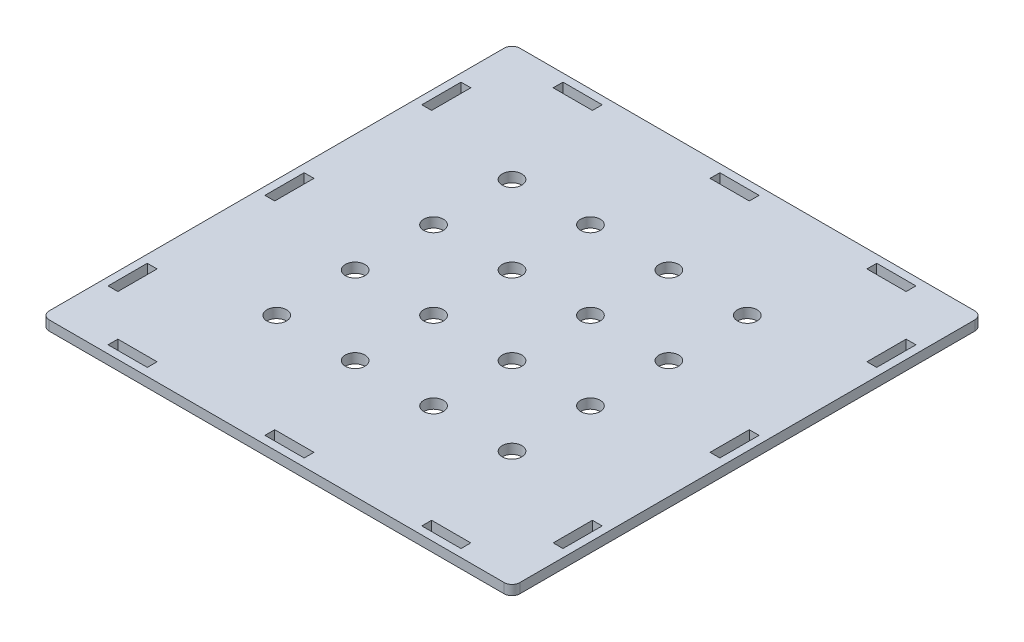
from build123d import *

# Parameters (mm, degrees)
SKETCH1_W           = 120
SKETCH1_H           = 120
SKETCH1_R           = 2.5
SKETCH1_W_2         = 2.5
SKETCH1_H_2         = 10
SKETCH1_W_3         = 10
SKETCH1_H_3         = 2.5
BOSS_EXTRUDE1_DEPTH = 2.5
FILLET1_R           = 2


with BuildPart() as part:
    # Sketch1 → Boss-Extrude1 (new body)
    with BuildSketch(Plane(origin=(0, 0, 0), x_dir=(1, 0, 0), z_dir=(0, 1, 0))):
        Rectangle(SKETCH1_W, SKETCH1_H)
        with Locations((-30, 30)):
            Circle(SKETCH1_R, mode=Mode.SUBTRACT)
        with Locations((-30, 10)):
            Circle(SKETCH1_R, mode=Mode.SUBTRACT)
        with Locations((-30, -10)):
            Circle(SKETCH1_R, mode=Mode.SUBTRACT)
        with Locations((-30, -30)):
            Circle(SKETCH1_R, mode=Mode.SUBTRACT)
        with Locations((-10, 30)):
            Circle(SKETCH1_R, mode=Mode.SUBTRACT)
        with Locations((-10, 10)):
            Circle(SKETCH1_R, mode=Mode.SUBTRACT)
        with Locations((-10, -10)):
            Circle(SKETCH1_R, mode=Mode.SUBTRACT)
        with Locations((-10, -30)):
            Circle(SKETCH1_R, mode=Mode.SUBTRACT)
        with Locations((10, 30)):
            Circle(SKETCH1_R, mode=Mode.SUBTRACT)
        with Locations((10, 10)):
            Circle(SKETCH1_R, mode=Mode.SUBTRACT)
        with Locations((10, -10)):
            Circle(SKETCH1_R, mode=Mode.SUBTRACT)
        with Locations((10, -30)):
            Circle(SKETCH1_R, mode=Mode.SUBTRACT)
        with Locations((30, 30)):
            Circle(SKETCH1_R, mode=Mode.SUBTRACT)
        with Locations((30, 10)):
            Circle(SKETCH1_R, mode=Mode.SUBTRACT)
        with Locations((30, -10)):
            Circle(SKETCH1_R, mode=Mode.SUBTRACT)
        with Locations((30, -30)):
            Circle(SKETCH1_R, mode=Mode.SUBTRACT)
        with Locations((-56.75, 0)):
            Rectangle(SKETCH1_W_2, SKETCH1_H_2, mode=Mode.SUBTRACT)
        with Locations((-40, 56.75)):
            Rectangle(SKETCH1_W_3, SKETCH1_H_3, mode=Mode.SUBTRACT)
        with Locations((-56.75, 40)):
            Rectangle(SKETCH1_W_2, SKETCH1_H_2, mode=Mode.SUBTRACT)
        with Locations((-56.75, -40)):
            Rectangle(SKETCH1_W_2, SKETCH1_H_2, mode=Mode.SUBTRACT)
        with Locations((0, 56.75)):
            Rectangle(SKETCH1_W_3, SKETCH1_H_3, mode=Mode.SUBTRACT)
        with Locations((40, 56.75)):
            Rectangle(SKETCH1_W_3, SKETCH1_H_3, mode=Mode.SUBTRACT)
        with Locations((40, -56.75)):
            Rectangle(SKETCH1_W_3, SKETCH1_H_3, mode=Mode.SUBTRACT)
        with Locations((0, -56.75)):
            Rectangle(SKETCH1_W_3, SKETCH1_H_3, mode=Mode.SUBTRACT)
        with Locations((-40, -56.75)):
            Rectangle(SKETCH1_W_3, SKETCH1_H_3, mode=Mode.SUBTRACT)
        with Locations((56.75, 40)):
            Rectangle(SKETCH1_W_2, SKETCH1_H_2, mode=Mode.SUBTRACT)
        with Locations((56.75, 0)):
            Rectangle(SKETCH1_W_2, SKETCH1_H_2, mode=Mode.SUBTRACT)
        with Locations((56.75, -40)):
            Rectangle(SKETCH1_W_2, SKETCH1_H_2, mode=Mode.SUBTRACT)
    extrude(amount=BOSS_EXTRUDE1_DEPTH)

    # Fillet1
    fillet1_edges = [part.edges().sort_by_distance(p)[0] for p in [
        (60, 1.25, -60),
        (60, 1.25, 60),
        (-60, 1.25, 60),
        (-60, 1.25, -60),
    ]]
    fillet(fillet1_edges, radius=FILLET1_R)


solid = part.part
